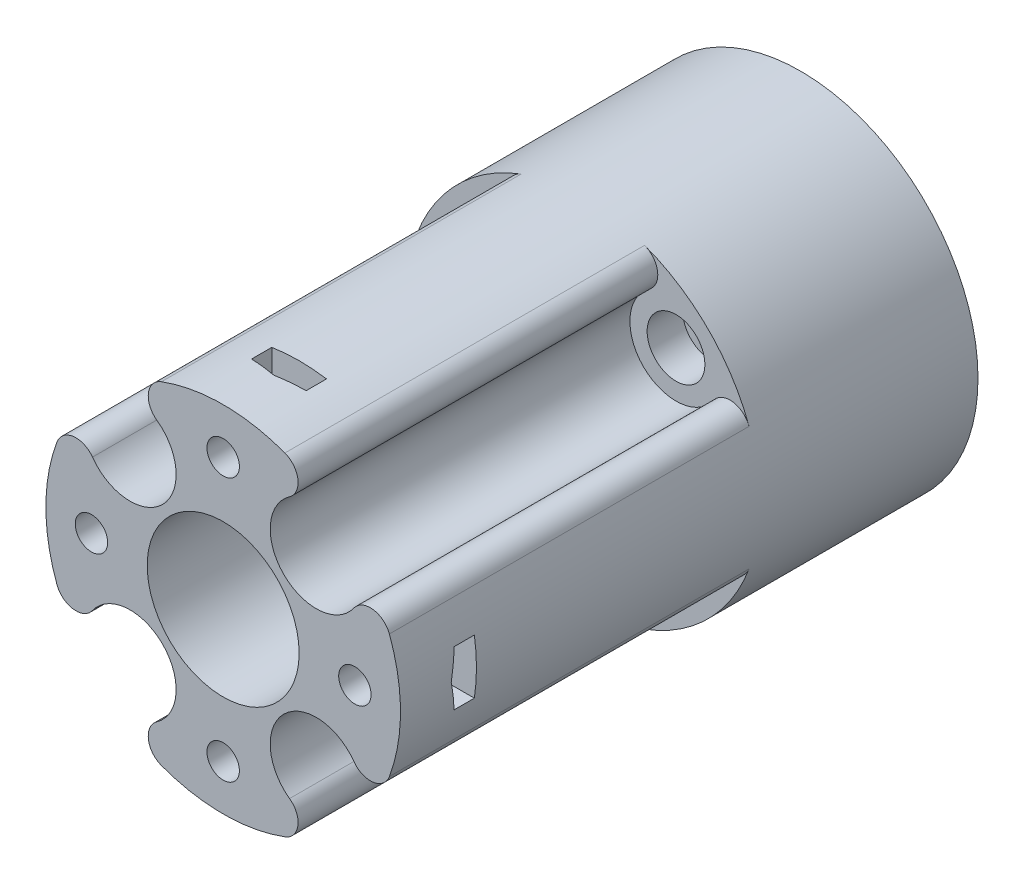
from build123d import *

# Parameters (mm, degrees)
SKETCH1_R           = 17.5
SKETCH1_R_2         = 2.85
BOSS_EXTRUDE1_DEPTH = 57
SKETCH1_3_R         = 2.85
SKETCH1_3_R_2       = 1.6
BOSS_EXTRUDE2_DEPTH = 18
SKETCH2_R           = 4.55
CUT_EXTRUDE1_DEPTH  = 35.5
FILLET1_R           = 2
CUT_EXTRUDE2_START  = -7.5
SKETCH3_R           = 1.6
CUT_EXTRUDE2_DEPTH  = 2.5
CUT_EXTRUDE3_START  = -10
SKETCH3_2_R         = 1.6
CUT_EXTRUDE3_DEPTH  = 10
CHAMFER1_SIZE       = 2.75
CHAMFER1_SIZE_2     = 0.5
SKETCH4_R           = 7.5
CUT_EXTRUDE4_DEPTH  = 63.140968921
SKETCH5_R           = 2
CUT_EXTRUDE5_DEPTH  = 10


with BuildPart() as part:
    # Sketch1 → Boss-Extrude1 (new body)
    with BuildSketch(Plane(origin=(0, 0, 0), x_dir=(0, 1, 0), z_dir=(0, 0, 1))):
        with Locations(Location((0, 0, 0), (0, 0, 90))):
            Circle(SKETCH1_R)
        with Locations(Location((-9.192388155, 9.192388155, 0), (0, 0, 90))):
            Circle(SKETCH1_R_2, mode=Mode.SUBTRACT)
        with Locations(Location((-9.192388155, -9.192388155, 0), (0, 0, 90))):
            Circle(SKETCH1_R_2, mode=Mode.SUBTRACT)
        with Locations(Location((9.192388155, -9.192388155, 0), (0, 0, 90))):
            Circle(SKETCH1_R_2, mode=Mode.SUBTRACT)
        with Locations(Location((9.192388155, 9.192388155, 0), (0, 0, 90))):
            Circle(SKETCH1_R_2, mode=Mode.SUBTRACT)
    extrude(amount=BOSS_EXTRUDE1_DEPTH)

    # Sketch1<3> → Boss-Extrude2 (add)
    # profile 1 of 4: a face of its own
    with BuildSketch(Plane(origin=(0, 0, 0), x_dir=(0, 1, 0), z_dir=(0, 0, 1))):
        with Locations(Location((-9.192388155, -9.192388155, 0), (0, 0, 90))):
            Circle(SKETCH1_3_R)
        with Locations(Location((-9.192388155, -9.192388155, 0), (0, 0, 270))):
            Circle(SKETCH1_3_R_2, mode=Mode.SUBTRACT)
    # profile 2 of 4: a face of its own
    with BuildSketch(Plane(origin=(0, 0, 0), x_dir=(0, 1, 0), z_dir=(0, 0, 1))):
        with Locations(Location((-9.192388155, 9.192388155, 0), (0, 0, 90))):
            Circle(SKETCH1_3_R)
        with Locations(Location((-9.192388155, 9.192388155, 0), (0, 0, 270))):
            Circle(SKETCH1_3_R_2, mode=Mode.SUBTRACT)
    # profile 3 of 4: a face of its own
    with BuildSketch(Plane(origin=(0, 0, 0), x_dir=(0, 1, 0), z_dir=(0, 0, 1))):
        with Locations(Location((9.192388155, -9.192388155, 0), (0, 0, 90))):
            Circle(SKETCH1_3_R)
        with Locations(Location((9.192388155, -9.192388155, 0), (0, 0, 270))):
            Circle(SKETCH1_3_R_2, mode=Mode.SUBTRACT)
    # profile 4 of 4: a face of its own
    with BuildSketch(Plane(origin=(0, 0, 0), x_dir=(0, 1, 0), z_dir=(0, 0, 1))):
        with Locations(Location((9.192388155, 9.192388155, 0), (0, 0, 90))):
            Circle(SKETCH1_3_R)
        with Locations(Location((9.192388155, 9.192388155, 0), (0, 0, 270))):
            Circle(SKETCH1_3_R_2, mode=Mode.SUBTRACT)
    extrude(amount=BOSS_EXTRUDE2_DEPTH)

    # Sketch2 → Cut-Extrude1 (cut)
    with BuildSketch(Plane.XY.offset(57)):
        with Locations((-9.192388155, 9.192388155)):
            Circle(SKETCH2_R)
        with Locations((9.192388155, 9.192388155)):
            Circle(SKETCH2_R)
        with Locations((9.192388155, -9.192388155)):
            Circle(SKETCH2_R)
        with Locations((-9.192388155, -9.192388155)):
            Circle(SKETCH2_R)
    extrude(amount=-CUT_EXTRUDE1_DEPTH, mode=Mode.SUBTRACT)

    # Fillet1
    fillet1_edges = [part.edges().sort_by_distance(p)[0] for p in [
        (-12.913801236, -11.810323351, 39.25),
        (-11.810323351, -12.913801236, 39.25),
        (11.810323351, -12.913801236, 39.25),
        (12.913801236, -11.810323351, 39.25),
        (12.913801236, 11.810323351, 39.25),
        (11.810323351, 12.913801236, 39.25),
        (-11.810323351, 12.913801236, 39.25),
        (-12.913801236, 11.810323351, 39.25),
    ]]
    fillet(fillet1_edges, radius=FILLET1_R)

    # Sketch3 → Cut-Extrude2 (cut)
    # profile 1 of 4: a face of its own
    with BuildSketch(Plane.XY.offset(57).offset(CUT_EXTRUDE2_START)):
        with BuildLine():
            Line((-2.699770647, 15.699312019), (-2.699770647, 17.29049561))
            ThreePointArc((-2.699770647, 17.29049561), (0.000232132, 17.499999998), (2.700229353, 17.290423981))
            Line((2.700229353, 17.290423981), (2.700229353, 15.700229353))
            Line((2.700229353, 15.700229353), (2.700229353, 10.300229353))
            Line((2.700229353, 10.300229353), (-2.699770647, 10.300229353))
            Line((-2.699770647, 10.300229353), (-2.699770647, 15.699312019))
        make_face()
        with Locations((0, 13)):
            Circle(SKETCH3_R, mode=Mode.SUBTRACT)
    # profile 2 of 4: a face of its own
    with BuildSketch(Plane.XY.offset(57).offset(CUT_EXTRUDE2_START)):
        with BuildLine():
            Line((15.700229353, -2.700229353), (10.300229353, -2.700229353))
            Line((10.300229353, -2.700229353), (10.300229353, 2.699770647))
            Line((10.300229353, 2.699770647), (15.699312019, 2.699770647))
            Line((15.699312019, 2.699770647), (17.29049561, 2.699770647))
            ThreePointArc((17.29049561, 2.699770647), (17.499999998, -0.000232132), (17.290423981, -2.700229353))
            Line((17.290423981, -2.700229353), (15.700229353, -2.700229353))
        make_face()
        with Locations((13, 0)):
            Circle(SKETCH3_R, mode=Mode.SUBTRACT)
    # profile 3 of 4: a face of its own
    with BuildSketch(Plane.XY.offset(57).offset(CUT_EXTRUDE2_START)):
        with BuildLine():
            Line((-2.700229353, -15.700229353), (-2.700229353, -10.300229353))
            Line((-2.700229353, -10.300229353), (2.699770647, -10.300229353))
            Line((2.699770647, -10.300229353), (2.699770647, -15.699312019))
            Line((2.699770647, -15.699312019), (2.699770647, -17.29049561))
            ThreePointArc((2.699770647, -17.29049561), (-0.000232132, -17.499999998), (-2.700229353, -17.290423981))
            Line((-2.700229353, -17.290423981), (-2.700229353, -15.700229353))
        make_face()
        with Locations((0, -13)):
            Circle(SKETCH3_R, mode=Mode.SUBTRACT)
    # profile 4 of 4: a face of its own
    with BuildSketch(Plane.XY.offset(57).offset(CUT_EXTRUDE2_START)):
        with BuildLine():
            Line((-15.700229353, 2.700229353), (-10.300229353, 2.700229353))
            Line((-10.300229353, 2.700229353), (-10.300229353, -2.699770647))
            Line((-10.300229353, -2.699770647), (-15.699312019, -2.699770647))
            Line((-15.699312019, -2.699770647), (-17.29049561, -2.699770647))
            ThreePointArc((-17.29049561, -2.699770647), (-17.499999998, 0.000232132), (-17.290423981, 2.700229353))
            Line((-17.290423981, 2.700229353), (-15.700229353, 2.700229353))
        make_face()
        with Locations((-13, 0)):
            Circle(SKETCH3_R, mode=Mode.SUBTRACT)
    extrude(amount=CUT_EXTRUDE2_DEPTH, mode=Mode.SUBTRACT)

    # Sketch3<2> → Cut-Extrude3 (cut)
    with BuildSketch(Plane.XY.offset(57).offset(CUT_EXTRUDE3_START)):
        with Locations((-13, 0)):
            Circle(SKETCH3_2_R)
        with Locations((0, 13)):
            Circle(SKETCH3_2_R)
        with Locations((13, 0)):
            Circle(SKETCH3_2_R)
        with Locations((0, -13)):
            Circle(SKETCH3_2_R)
    extrude(amount=CUT_EXTRUDE3_DEPTH, mode=Mode.SUBTRACT)

    # Chamfer1
    # the kernel refuses this chamfer: 2.75, 0.5 mm, written as the material it adds along each edge
    with BuildSketch(Plane(origin=(-3.154495794, -2.699770647, 52), x_dir=(0, 0.9999763028084744, 0.006884317068104265), z_dir=(-1, 0, 0))) as chamfer1_piece_1_section:
        Polygon((CHAMFER1_SIZE * 0.999976302808, CHAMFER1_SIZE * 0.0068843170681), (-CHAMFER1_SIZE_2 * 0.0068843170681, CHAMFER1_SIZE_2 * 0.999976302808), (0, 0), align=None)
    chamfer1_piece_1 = extrude(amount=21.281733376, mode=Mode.PRIVATE)
    chamfer1_piece_1 = chamfer1_piece_1 & Plane(origin=(0, 0, 51.863927103), x_dir=(-1, 0, 0), z_dir=(0, 0, -1)) * Cylinder(17.5, 54, mode=Mode.PRIVATE)
    chamfer1_piece_1 = chamfer1_piece_1 - Plane(origin=(-13, 0, 51.863927103), x_dir=(1, 0, 0), z_dir=(0, 0, -1)) * Cylinder(1.6, 54, mode=Mode.PRIVATE)
    add(chamfer1_piece_1)
    with BuildSketch(Plane(origin=(-24.43615754, 2.700229353, 52), x_dir=(0, -0.9999763028084744, 0.006884317068104265), z_dir=(1, 0, 0))) as chamfer1_piece_2_section:
        Polygon((CHAMFER1_SIZE * 0.999976302808, CHAMFER1_SIZE * 0.0068843170681), (-CHAMFER1_SIZE_2 * 0.0068843170681, CHAMFER1_SIZE_2 * 0.999976302808), (0, 0), align=None)
    chamfer1_piece_2 = extrude(amount=21.281661746, mode=Mode.PRIVATE)
    chamfer1_piece_2 = chamfer1_piece_2 & Plane(origin=(0, 0, 51.851524539), x_dir=(-1, 0, 0), z_dir=(0, 0, -1)) * Cylinder(17.5, 54, mode=Mode.PRIVATE)
    chamfer1_piece_2 = chamfer1_piece_2 - Plane(origin=(-13, 0, 51.851524539), x_dir=(1, 0, 0), z_dir=(0, 0, -1)) * Cylinder(1.6, 54, mode=Mode.PRIVATE)
    add(chamfer1_piece_2)
    with BuildSketch(Plane(origin=(-2.699770647, 3.154495794, 52), x_dir=(0.9999763028084744, 0, 0.006884317068104265), z_dir=(0, 1, 0))) as chamfer1_piece_3_section:
        Polygon((CHAMFER1_SIZE * 0.999976302808, CHAMFER1_SIZE * 0.0068843170681), (-CHAMFER1_SIZE_2 * 0.0068843170681, CHAMFER1_SIZE_2 * 0.999976302808), (0, 0), align=None)
    chamfer1_piece_3 = extrude(amount=21.281733376, mode=Mode.PRIVATE)
    chamfer1_piece_3 = chamfer1_piece_3 & Plane(origin=(0, 0, 51.863927103), x_dir=(-1, 0, 0), z_dir=(0, 0, -1)) * Cylinder(17.5, 54, mode=Mode.PRIVATE)
    chamfer1_piece_3 = chamfer1_piece_3 - Plane(origin=(0, 13, 51.863927103), x_dir=(1, 0, 0), z_dir=(0, 0, -1)) * Cylinder(1.6, 54, mode=Mode.PRIVATE)
    add(chamfer1_piece_3)
    with BuildSketch(Plane(origin=(2.700229353, 24.43615754, 52), x_dir=(0.20388124945923355, 0, -0.9789956262001082), z_dir=(0, -1, 0))) as chamfer1_piece_4_section:
        Polygon((CHAMFER1_SIZE_2 * 0.9789956262, -CHAMFER1_SIZE_2 * 0.203881249459), (-CHAMFER1_SIZE * 0.203881249459, -CHAMFER1_SIZE * 0.9789956262), (0, 0), align=None)
    chamfer1_piece_4 = extrude(amount=21.281661746, mode=Mode.PRIVATE)
    chamfer1_piece_4 = chamfer1_piece_4 & Plane(origin=(0, 0, 51.851524604), x_dir=(-1, 0, 0), z_dir=(0, 0, -1)) * Cylinder(17.5, 54, mode=Mode.PRIVATE)
    chamfer1_piece_4 = chamfer1_piece_4 - Plane(origin=(0, 13, 51.851524604), x_dir=(1, 0, 0), z_dir=(0, 0, -1)) * Cylinder(1.6, 54, mode=Mode.PRIVATE)
    add(chamfer1_piece_4)
    with BuildSketch(Plane(origin=(3.154495794, 2.699770647, 52), x_dir=(0, -0.9999763028084744, 0.006884317068104265), z_dir=(1, 0, 0))) as chamfer1_piece_5_section:
        Polygon((CHAMFER1_SIZE * 0.999976302808, CHAMFER1_SIZE * 0.0068843170681), (-CHAMFER1_SIZE_2 * 0.0068843170681, CHAMFER1_SIZE_2 * 0.999976302808), (0, 0), align=None)
    chamfer1_piece_5 = extrude(amount=21.281733376, mode=Mode.PRIVATE)
    chamfer1_piece_5 = chamfer1_piece_5 & Plane(origin=(0, 0, 51.863927103), x_dir=(-1, 0, 0), z_dir=(0, 0, -1)) * Cylinder(17.5, 54, mode=Mode.PRIVATE)
    chamfer1_piece_5 = chamfer1_piece_5 - Plane(origin=(13, 0, 51.863927103), x_dir=(1, 0, 0), z_dir=(0, 0, -1)) * Cylinder(1.6, 54, mode=Mode.PRIVATE)
    add(chamfer1_piece_5)
    with BuildSketch(Plane(origin=(24.43615754, -2.700229353, 52), x_dir=(0, -0.20388124945923355, -0.9789956262001082), z_dir=(-1, 0, 0))) as chamfer1_piece_6_section:
        Polygon((CHAMFER1_SIZE_2 * 0.9789956262, -CHAMFER1_SIZE_2 * 0.203881249459), (-CHAMFER1_SIZE * 0.203881249459, -CHAMFER1_SIZE * 0.9789956262), (0, 0), align=None)
    chamfer1_piece_6 = extrude(amount=21.281661746, mode=Mode.PRIVATE)
    chamfer1_piece_6 = chamfer1_piece_6 & Plane(origin=(0, 0, 51.8515245), x_dir=(-1, 0, 0), z_dir=(0, 0, -1)) * Cylinder(17.5, 54, mode=Mode.PRIVATE)
    chamfer1_piece_6 = chamfer1_piece_6 - Plane(origin=(13, 0, 51.8515245), x_dir=(1, 0, 0), z_dir=(0, 0, -1)) * Cylinder(1.6, 54, mode=Mode.PRIVATE)
    add(chamfer1_piece_6)
    with BuildSketch(Plane(origin=(2.699770647, -3.154495794, 52), x_dir=(-0.9999763028084744, 0, 0.006884317068104265), z_dir=(0, -1, 0))) as chamfer1_piece_7_section:
        Polygon((CHAMFER1_SIZE * 0.999976302808, CHAMFER1_SIZE * 0.0068843170681), (-CHAMFER1_SIZE_2 * 0.0068843170681, CHAMFER1_SIZE_2 * 0.999976302808), (0, 0), align=None)
    chamfer1_piece_7 = extrude(amount=21.281733376, mode=Mode.PRIVATE)
    chamfer1_piece_7 = chamfer1_piece_7 & Plane(origin=(0, 0, 51.863927103), x_dir=(-1, 0, 0), z_dir=(0, 0, -1)) * Cylinder(17.5, 54, mode=Mode.PRIVATE)
    chamfer1_piece_7 = chamfer1_piece_7 - Plane(origin=(0, -13, 51.863927103), x_dir=(1, 0, 0), z_dir=(0, 0, -1)) * Cylinder(1.6, 54, mode=Mode.PRIVATE)
    add(chamfer1_piece_7)
    with BuildSketch(Plane(origin=(-2.700229353, -24.43615754, 52), x_dir=(-0.20388124945923355, 0, -0.9789956262001082), z_dir=(0, 1, 0))) as chamfer1_piece_8_section:
        Polygon((CHAMFER1_SIZE_2 * 0.9789956262, -CHAMFER1_SIZE_2 * 0.203881249459), (-CHAMFER1_SIZE * 0.203881249459, -CHAMFER1_SIZE * 0.9789956262), (0, 0), align=None)
    chamfer1_piece_8 = extrude(amount=21.281661746, mode=Mode.PRIVATE)
    chamfer1_piece_8 = chamfer1_piece_8 & Plane(origin=(0, 0, 51.851524701), x_dir=(-1, 0, 0), z_dir=(0, 0, -1)) * Cylinder(17.5, 54, mode=Mode.PRIVATE)
    chamfer1_piece_8 = chamfer1_piece_8 - Plane(origin=(0, -13, 51.851524701), x_dir=(1, 0, 0), z_dir=(0, 0, -1)) * Cylinder(1.6, 54, mode=Mode.PRIVATE)
    add(chamfer1_piece_8)

    # Sketch4 → Cut-Extrude4 (cut, through all)
    with BuildSketch(Plane.XY.offset(57)):
        Circle(SKETCH4_R)
    extrude(amount=-CUT_EXTRUDE4_DEPTH, mode=Mode.SUBTRACT)

    # Sketch5 → Cut-Extrude5 (cut)
    with BuildSketch(Plane(origin=(0, 0, 0), x_dir=(1, 0, 0), z_dir=(0, 0, -1))):
        with Locations(Location((0, 13, 0), (0, 0, 180))):
            Circle(SKETCH5_R)
        with Locations(Location((13, 0, 0), (0, 0, 180))):
            Circle(SKETCH5_R)
        with Locations(Location((0, -13, 0), (0, 0, 180))):
            Circle(SKETCH5_R)
        with Locations(Location((-13, 0, 0), (0, 0, 180))):
            Circle(SKETCH5_R)
    extrude(amount=-CUT_EXTRUDE5_DEPTH, mode=Mode.SUBTRACT)


solid = part.part
